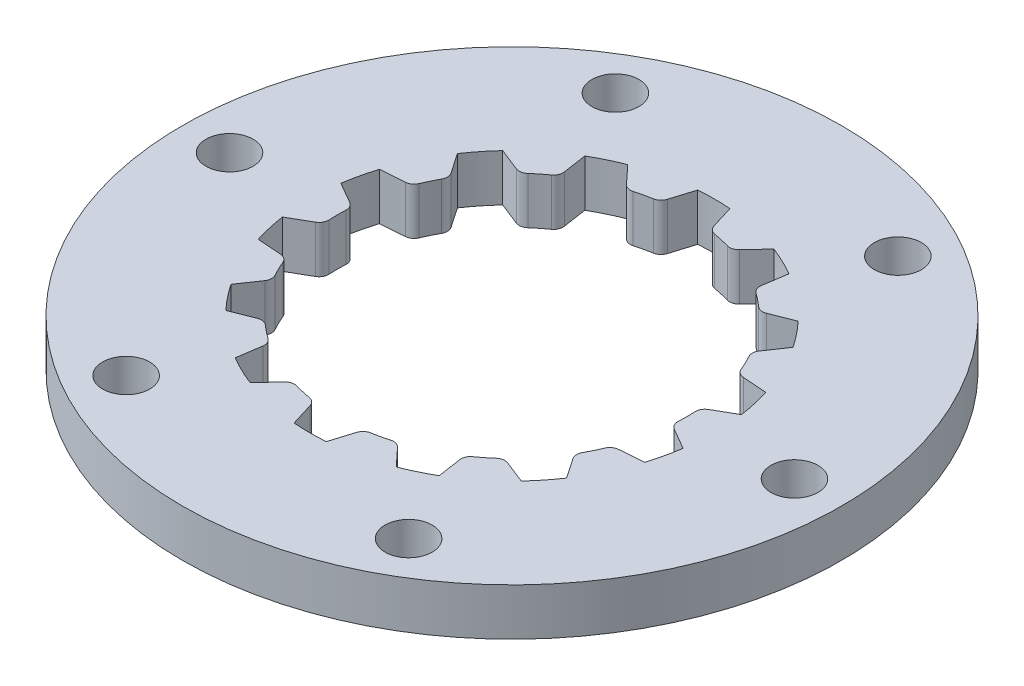
from build123d import *

# Parameters (mm, degrees)
TOOTH_DEPTH         = 6.35
CIRPATTERN2_COUNT   = 14
FILLET2_R           = 1.27
CIRPATTERN10_DEPTH  = 6.35
SKETCH2_R           = 44.45
SKETCH2_R_2         = 3.175
SKETCH2_R_3         = 33.655
BOSS_EXTRUDE2_DEPTH = 6.35


# Read off the part's stored shape, not the designer's step: CirPattern10
with BuildPart() as part:
    # Sketch1 → tooth (new body)
    with BuildSketch(Plane(origin=(0, 0, 0), x_dir=(1, 0, 0), z_dir=(0, 1, 0))):
        with BuildLine():
            Line((23.495, 1.905), (27.019279154, 3.939743518))
            ThreePointArc((27.019279154, 3.939743518), (26.594581963, 6.18799121), (25.983150393, 8.392789801))
            Line((25.983150393, 8.392789801), (32.025743508, 10.344601382))
            ThreePointArc((32.025743508, 10.344601382), (33.536845379, 2.817627907), (33.302832446, -4.855962941))
            Line((33.302832446, -4.855962941), (27.019279154, -3.939743518))
            Line((27.019279154, -3.939743518), (23.495, -1.905))
            ThreePointArc((23.495, -1.905), (23.572103215, 0), (23.495, 1.905))
        make_face()
    tooth = extrude(amount=TOOTH_DEPTH)

    # CirPattern2: tooth ×14 about axis
    cirpattern2_axis = Axis((0, 0, 0), (0, 1, 0))
    for i in range(1, CIRPATTERN2_COUNT):
        add(tooth.rotate(cirpattern2_axis, i * 360 / CIRPATTERN2_COUNT))

    # Fillet2
    fillet2_edges = [part.edges().sort_by_distance(p)[0] for p in [
        (20.341715028, 3.175, -11.910444144),
        (21.994812074, 3.175, -8.477752757),
    ]]
    fillet(fillet2_edges, radius=FILLET2_R)

    # CirPattern10 outline → CirPattern10 (cut)
    with BuildSketch(Plane(origin=(0, 0, 0), x_dir=(1, 0, 0), z_dir=(0, 1, 0))):
        with BuildLine():
            ThreePointArc((21.994812074, -8.477752757), (21.853716341, -8.835107925), (21.706815016, -9.190115986))
            ThreePointArc((21.706815016, -9.190115986), (22.135768899, -8.653514623), (22.781411207, -8.418805301))
            Line((22.781411207, -8.418805301), (21.994812074, -8.477752757))
        make_face()
        with BuildLine():
            ThreePointArc((20.786064589, -12.562185248), (20.567016331, -11.911062896), (20.719099799, -11.241127769))
            ThreePointArc((20.719099799, -11.241127769), (20.533134799, -11.577323755), (20.341715028, -11.910444144))
            Line((20.341715028, -11.910444144), (20.786064589, -12.562185248))
        make_face()
        with BuildLine():
            ThreePointArc((16.138281869, -17.181382608), (15.85610841, -17.442129345), (15.569722665, -17.698242459))
            ThreePointArc((15.569722665, -17.698242459), (16.189019364, -17.400897451), (16.872559541, -17.469565358))
            Line((16.872559541, -17.469565358), (16.138281869, -17.181382608))
        make_face()
        with BuildLine():
            ThreePointArc((13.277069174, -20.336873246), (13.362224913, -19.655190801), (13.789921341, -19.117586652))
            ThreePointArc((13.789921341, -19.117586652), (13.476502695, -19.339801579), (13.159503921, -19.556878753))
            Line((13.159503921, -19.556878753), (13.277069174, -20.336873246))
        make_face()
        with BuildLine():
            ThreePointArc((7.085367016, -22.482028918), (6.718003745, -22.594523135), (6.348855789, -22.70101496))
            ThreePointArc((6.348855789, -22.70101496), (7.035835999, -22.701819131), (7.62189053, -23.060263746))
            Line((7.62189053, -23.060263746), (7.085367016, -22.482028918))
        make_face()
        with BuildLine():
            ThreePointArc((3.138387377, -24.083594083), (3.510880975, -23.506367113), (4.12947984, -23.207573037))
            ThreePointArc((4.12947984, -23.207573037), (3.750683953, -23.271794514), (3.370891671, -23.329833676))
            Line((3.370891671, -23.329833676), (3.138387377, -24.083594083))
        make_face()
        with BuildLine():
            ThreePointArc((-3.370891671, -23.329833676), (-3.750683953, -23.271794514), (-4.12947984, -23.207573037))
            ThreePointArc((-4.12947984, -23.207573037), (-3.510880975, -23.506367113), (-3.138387377, -24.083594083))
            Line((-3.138387377, -24.083594083), (-3.370891671, -23.329833676))
        make_face()
        with BuildLine():
            ThreePointArc((-7.62189053, -23.060263746), (-7.035835999, -22.701819131), (-6.348855789, -22.701014959))
            ThreePointArc((-6.348855789, -22.701014959), (-6.718003745, -22.594523135), (-7.085367016, -22.482028918))
            Line((-7.085367016, -22.482028918), (-7.62189053, -23.060263746))
        make_face()
        with BuildLine():
            ThreePointArc((-13.159503921, -19.556878753), (-13.476502695, -19.339801579), (-13.789921341, -19.117586652))
            ThreePointArc((-13.789921341, -19.117586652), (-13.362224913, -19.655190801), (-13.277069174, -20.336873246))
            Line((-13.277069174, -20.336873246), (-13.159503921, -19.556878753))
        make_face()
        with BuildLine():
            ThreePointArc((-16.872559541, -17.469565358), (-16.189019364, -17.400897451), (-15.569722665, -17.698242459))
            ThreePointArc((-15.569722665, -17.698242459), (-15.85610841, -17.442129345), (-16.138281869, -17.181382608))
            Line((-16.138281869, -17.181382608), (-16.872559541, -17.469565358))
        make_face()
        with BuildLine():
            ThreePointArc((-20.341715028, -11.910444144), (-20.533134799, -11.577323755), (-20.719099799, -11.241127769))
            ThreePointArc((-20.719099799, -11.241127769), (-20.567016331, -11.911062896), (-20.786064589, -12.562185248))
            Line((-20.786064589, -12.562185248), (-20.341715028, -11.910444144))
        make_face()
        with BuildLine():
            ThreePointArc((-22.781411207, -8.418805301), (-22.135768899, -8.653514623), (-21.706815017, -9.190115986))
            ThreePointArc((-21.706815017, -9.190115986), (-21.853716341, -8.835107925), (-21.994812074, -8.477752757))
            Line((-21.994812074, -8.477752757), (-22.781411207, -8.418805301))
        make_face()
        with BuildLine():
            ThreePointArc((-23.495, -1.905), (-23.522927734, -1.521814974), (-23.544606438, -1.138225668))
            ThreePointArc((-23.544606438, -1.138225668), (-23.698257926, -1.807802905), (-24.178124988, -2.299402395))
            Line((-24.178124988, -2.299402395), (-23.495, -1.905))
        make_face()
        with BuildLine():
            ThreePointArc((-24.178124988, 2.299402395), (-23.698257926, 1.807802905), (-23.544606438, 1.138225668))
            ThreePointArc((-23.544606438, 1.138225668), (-23.522927734, 1.521814974), (-23.495, 1.905))
            Line((-23.495, 1.905), (-24.178124988, 2.299402395))
        make_face()
        with BuildLine():
            ThreePointArc((-21.994812074, 8.477752757), (-21.853716341, 8.835107925), (-21.706815016, 9.190115986))
            ThreePointArc((-21.706815016, 9.190115986), (-22.135768899, 8.653514623), (-22.781411207, 8.418805301))
            Line((-22.781411207, 8.418805301), (-21.994812074, 8.477752757))
        make_face()
        with BuildLine():
            ThreePointArc((-20.786064589, 12.562185248), (-20.567016331, 11.911062896), (-20.719099799, 11.241127769))
            ThreePointArc((-20.719099799, 11.241127769), (-20.533134799, 11.577323755), (-20.341715028, 11.910444144))
            Line((-20.341715028, 11.910444144), (-20.786064589, 12.562185248))
        make_face()
        with BuildLine():
            ThreePointArc((-16.138281869, 17.181382608), (-15.85610841, 17.442129345), (-15.569722665, 17.698242459))
            ThreePointArc((-15.569722665, 17.698242459), (-16.189019364, 17.400897451), (-16.872559541, 17.469565358))
            Line((-16.872559541, 17.469565358), (-16.138281869, 17.181382608))
        make_face()
        with BuildLine():
            ThreePointArc((-13.277069174, 20.336873246), (-13.362224913, 19.655190801), (-13.789921341, 19.117586652))
            ThreePointArc((-13.789921341, 19.117586652), (-13.476502695, 19.339801579), (-13.159503921, 19.556878753))
            Line((-13.159503921, 19.556878753), (-13.277069174, 20.336873246))
        make_face()
        with BuildLine():
            ThreePointArc((-7.085367016, 22.482028918), (-6.718003745, 22.594523135), (-6.348855789, 22.70101496))
            ThreePointArc((-6.348855789, 22.70101496), (-7.035835999, 22.701819131), (-7.62189053, 23.060263746))
            Line((-7.62189053, 23.060263746), (-7.085367016, 22.482028918))
        make_face()
        with BuildLine():
            ThreePointArc((-3.138387377, 24.083594083), (-3.510880975, 23.506367113), (-4.12947984, 23.207573037))
            ThreePointArc((-4.12947984, 23.207573037), (-3.750683953, 23.271794514), (-3.370891671, 23.329833676))
            Line((-3.370891671, 23.329833676), (-3.138387377, 24.083594083))
        make_face()
        with BuildLine():
            ThreePointArc((3.370891671, 23.329833676), (3.750683953, 23.271794514), (4.12947984, 23.207573037))
            ThreePointArc((4.12947984, 23.207573037), (3.510880975, 23.506367113), (3.138387377, 24.083594083))
            Line((3.138387377, 24.083594083), (3.370891671, 23.329833676))
        make_face()
        with BuildLine():
            ThreePointArc((7.62189053, 23.060263746), (7.035835999, 22.701819131), (6.348855789, 22.701014959))
            ThreePointArc((6.348855789, 22.701014959), (6.718003745, 22.594523135), (7.085367016, 22.482028918))
            Line((7.085367016, 22.482028918), (7.62189053, 23.060263746))
        make_face()
        with BuildLine():
            ThreePointArc((13.159503921, 19.556878753), (13.476502695, 19.339801579), (13.789921341, 19.117586652))
            ThreePointArc((13.789921341, 19.117586652), (13.362224913, 19.655190801), (13.277069174, 20.336873246))
            Line((13.277069174, 20.336873246), (13.159503921, 19.556878753))
        make_face()
        with BuildLine():
            ThreePointArc((16.872559541, 17.469565358), (16.189019364, 17.400897451), (15.569722665, 17.698242459))
            ThreePointArc((15.569722665, 17.698242459), (15.85610841, 17.442129345), (16.138281869, 17.181382608))
            Line((16.138281869, 17.181382608), (16.872559541, 17.469565358))
        make_face()
        with BuildLine():
            ThreePointArc((23.495, 1.905), (23.522927734, 1.521814974), (23.544606438, 1.138225668))
            ThreePointArc((23.544606438, 1.138225668), (23.698257926, 1.807802905), (24.178124988, 2.299402395))
            Line((24.178124988, 2.299402395), (23.495, 1.905))
        make_face()
        with BuildLine():
            ThreePointArc((24.178124988, -2.299402395), (23.698257926, -1.807802905), (23.544606438, -1.138225668))
            ThreePointArc((23.544606438, -1.138225668), (23.522927734, -1.521814974), (23.495, -1.905))
            Line((23.495, -1.905), (24.178124988, -2.299402395))
        make_face()
    extrude(amount=CIRPATTERN10_DEPTH, mode=Mode.SUBTRACT)

    # Sketch2 → Boss-Extrude2 (add)
    with BuildSketch(Plane.XZ):
        with Locations(Location((0, 0, 0), (0, 0, 270))):
            Circle(SKETCH2_R)
        with Locations(Location((38.1, 0, 0), (0, 0, 270))):
            Circle(SKETCH2_R_2, mode=Mode.SUBTRACT)
        Circle(SKETCH2_R_3, mode=Mode.SUBTRACT)
        with Locations(Location((19.05, -32.995567884, 0), (0, 0, 270))):
            Circle(SKETCH2_R_2, mode=Mode.SUBTRACT)
        with Locations(Location((-19.05, -32.995567884, 0), (0, 0, 270))):
            Circle(SKETCH2_R_2, mode=Mode.SUBTRACT)
        with Locations(Location((-38.1, 0, 0), (0, 0, 270))):
            Circle(SKETCH2_R_2, mode=Mode.SUBTRACT)
        with Locations(Location((-19.05, 32.995567884, 0), (0, 0, 270))):
            Circle(SKETCH2_R_2, mode=Mode.SUBTRACT)
        with Locations(Location((19.05, 32.995567884, 0), (0, 0, 270))):
            Circle(SKETCH2_R_2, mode=Mode.SUBTRACT)
    extrude(amount=-BOSS_EXTRUDE2_DEPTH)


solid = part.part
